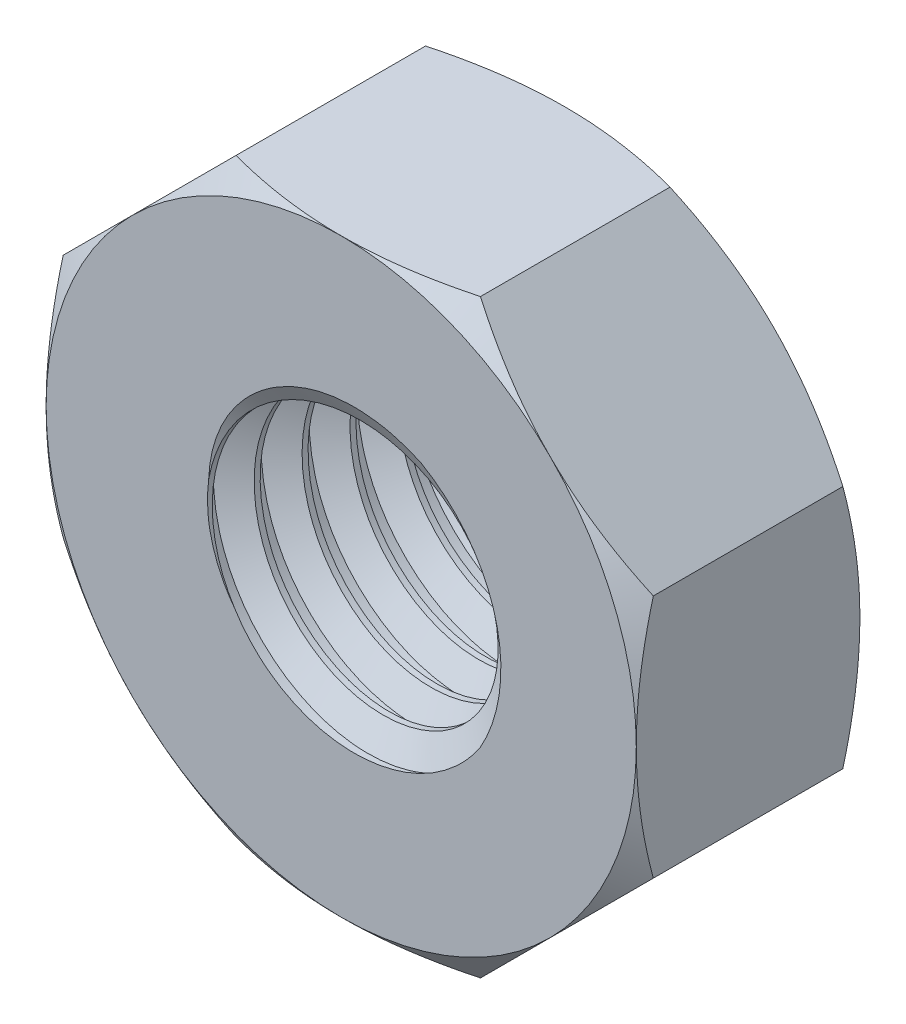
from build123d import *

# Parameters (mm, degrees)
SKETCH2_R           = 5
BOSS_EXTRUDE1_DEPTH = 3.5
THREAD3_PITCH       = 1.5
THREAD3_FROM        = 2
THREAD3_TO          = 9


with BuildPart() as part:
    # Sketch2 → Boss-Extrude1 (new, symmetric)
    with BuildSketch(Plane.XY):
        Polygon((3.826834324, 9.238795325), (-3.826834324, 9.238795325), (-9.238795325, 3.826834324), (-9.238795325, -3.826834324), (-3.826834324, -9.238795325), (3.826834324, -9.238795325), (9.238795325, -3.826834324), (9.238795325, 3.826834324), align=None)
        Circle(SKETCH2_R, mode=Mode.SUBTRACT)
    extrude(amount=BOSS_EXTRUDE1_DEPTH, both=True)

    # Thread3: arcs per turn and ends read off the stored shape
    # Thread3: the profile of Thread Profile3 profile screwed along a right-hand helix through 6 turns, 8 arcs to a turn; built about Z, then put on its axis
    thread3_z = Axis((0, 0, 0), (0, 0, 1))
    thread3_corners = [(5.0003, 0, -0.000173205), (4.188101188, 0, 0.468749998), (4.188101188, 0, 0.656249998), (5.0003, 0, 1.125173201)]
    with BuildLine(mode=Mode.PRIVATE) as thread3_profile:
        Line(thread3_corners[0], thread3_corners[1])
        Line(thread3_corners[1], thread3_corners[2])
        Line(thread3_corners[2], thread3_corners[3])
        Line(thread3_corners[3], thread3_corners[0])
    thread3_cap = Face(thread3_profile.wire())
    thread3_turn_angles = [0, 22.5, 45, 67.5, 90, 112.5, 135, 157.5, 180, 202.5, 225, 247.5, 270, 292.5, 315, 337.5, 360]
    thread3_turn_weights = [1, 0.9238795325112867, 1, 0.9238795325112867, 1, 0.9238795325112867, 1, 0.9238795325112867, 1, 0.9238795325112867, 1, 0.9238795325112867, 1, 0.9238795325112867, 1, 0.9238795325112867, 1]
    thread3_turn_rails = [Edge.make_bspline([Vector(p[0], p[1], 0).rotate(thread3_z, thread3_turn_angles[k]) / thread3_turn_weights[k] + Vector(0, 0, p[2] + THREAD3_PITCH * thread3_turn_angles[k] / 360) for k in range(17)], [0, 0, 0, 1, 1, 2, 2, 3, 3, 4, 4, 5, 5, 6, 6, 7, 7, 8, 8, 8], 2, thread3_turn_weights) for p in thread3_corners]
    thread3_turn_sides = [Face.make_surface_from_curves(thread3_turn_rails[p[0]], thread3_turn_rails[p[1]]) for p in [(0, 1), (1, 2), (2, 3), (3, 0)]]
    thread3 = Plane(origin=(0, 0, 5.5), x_dir=(-1, 0, 0), z_dir=(0, 0, -1)) * split(split(Solid(Shell([*[p.moved(Location((0, 0, THREAD3_PITCH * i))) for i in range(6) for p in thread3_turn_sides], thread3_cap, thread3_cap.rotate(thread3_z, 2160).moved(Location((0, 0, THREAD3_PITCH * 2160 / 360)))])), bisect_by=Plane.XY.offset(THREAD3_FROM), keep=Keep.TOP, mode=Mode.PRIVATE), bisect_by=Plane.XY.offset(THREAD3_TO), keep=Keep.BOTTOM, mode=Mode.PRIVATE)
    add(thread3)

    # Sketch5 → Cut-Revolve3 (revolve, cut)
    with BuildSketch(Plane(origin=(0, 0, 0), x_dir=(0, 0, -1), z_dir=(1, 0, 0))):
        Polygon((-3.5, 9.238795325), (-3.5, 11.238795325), (-2.099584924, 11.238795325), align=None)
        Polygon((2.099584924, 11.238795325), (3.5, 9.238795325), (3.5, 11.238795325), align=None)
    revolve(axis=Axis((0, 0, 5.762830409), (0, 0, -1)), mode=Mode.SUBTRACT)


solid = part.part
